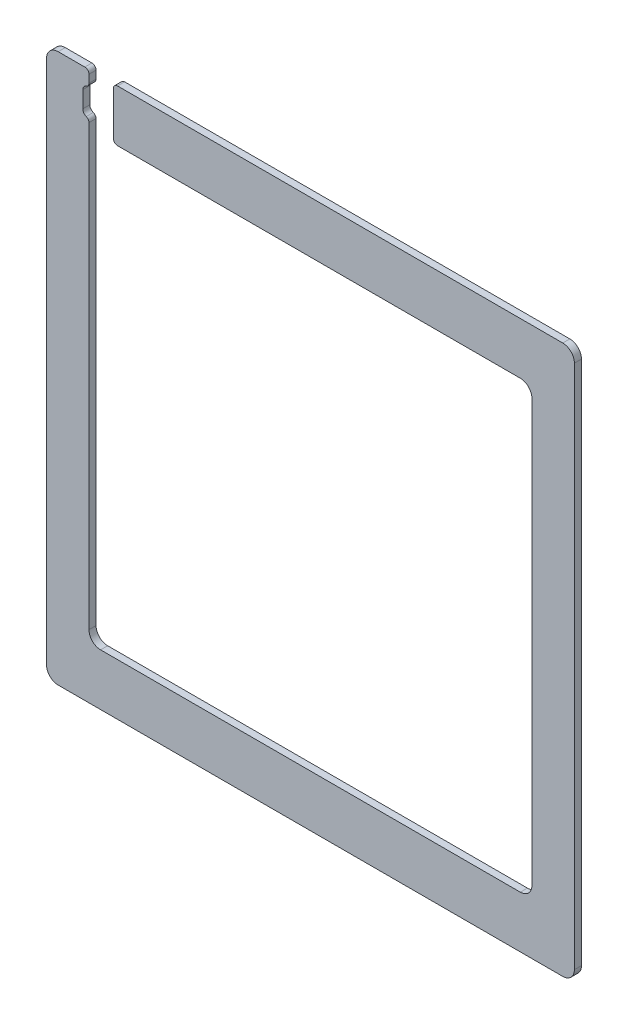
from build123d import *

# Parameters (mm, degrees)
SKETCH1_W           = 323.85
SKETCH1_H           = 336.55
BOSS_EXTRUDE1_DEPTH = 4.3434
SKETCH2_W           = 271.78
SKETCH2_H           = 273.05
CUT_EXTRUDE1_DEPTH  = 234.570217223
FILLET1_R           = 7.14375
CUT_EXTRUDE2_DEPTH  = 234.570217223
SKETCH4_W           = 14.979655554
SKETCH4_H           = 46.925096095
CUT_EXTRUDE3_DEPTH  = 234.570217223
FILLET2_R           = 2.54


with BuildPart() as part:
    # Sketch1 → Boss-Extrude1 (new body)
    with BuildSketch(Plane.XY):
        Rectangle(SKETCH1_W, SKETCH1_H)
    extrude(amount=BOSS_EXTRUDE1_DEPTH)

    # Sketch2 → Cut-Extrude1 (cut, through all)
    with BuildSketch(Plane.XY.offset(4.3434)):
        Rectangle(SKETCH2_W, SKETCH2_H)
    extrude(amount=-CUT_EXTRUDE1_DEPTH, mode=Mode.SUBTRACT)

    # Fillet1
    fillet1_edges = [part.edges().sort_by_distance(p)[0] for p in [
        (135.89, -136.525, 2.1717),
        (135.89, 136.525, 2.1717),
        (-135.89, 136.525, 2.1717),
        (-135.89, -136.525, 2.1717),
        (-161.925, -168.275, 2.1717),
        (161.925, -168.275, 2.1717),
        (161.925, 168.275, 2.1717),
        (-161.925, 168.275, 2.1717),
    ]]
    fillet(fillet1_edges, radius=FILLET1_R)

    # Sketch3 → Cut-Extrude2 (cut, through all)
    with BuildSketch(Plane.XY.offset(4.3434)):
        with BuildLine():
            Line((-139.7, 145.415), (-139.7, 155.575))
            ThreePointArc((-139.7, 155.575), (-136.525, 158.75), (-133.35, 155.575))
            Line((-133.35, 155.575), (-133.35, 145.415))
            ThreePointArc((-133.35, 145.415), (-136.525, 142.24), (-139.7, 145.415))
        make_face()
    extrude(amount=-CUT_EXTRUDE2_DEPTH, mode=Mode.SUBTRACT)

    # Sketch4 → Cut-Extrude3 (cut, through all)
    with BuildSketch(Plane.XY.offset(4.3434)):
        with Locations((-128.400172223, 144.812451952)):
            Rectangle(SKETCH4_W, SKETCH4_H)
    extrude(amount=-CUT_EXTRUDE3_DEPTH, mode=Mode.SUBTRACT)

    # Fillet2
    fillet2_edges = [part.edges().sort_by_distance(p)[0] for p in [
        (-135.89, 168.275, 2.1717),
        (-120.910344446, 168.275, 2.1717),
        (-120.910344446, 136.525, 2.1717),
        (-135.89, 142.304148027, 2.1717),
        (-135.89, 158.685851973, 2.1717),
    ]]
    fillet(fillet2_edges, radius=FILLET2_R)


solid = part.part
